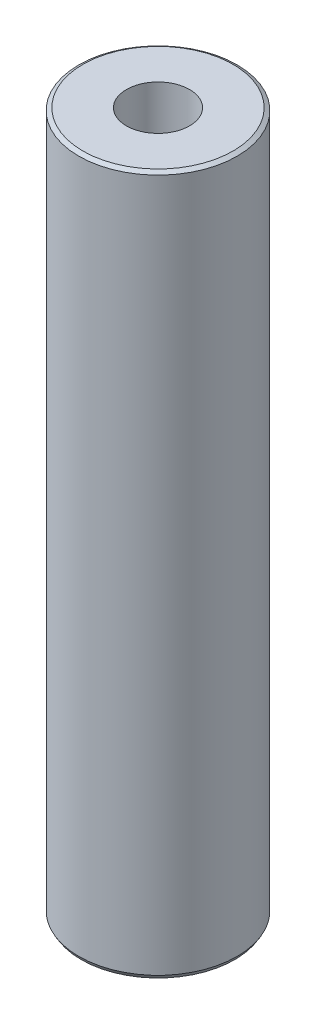
from build123d import *
from OCP.BRepFilletAPI import BRepFilletAPI_MakeChamfer

# Parameters (mm, degrees)
SKETCH1_R           = 27.5
BOSS_EXTRUDE1_DEPTH = 243.020051397
SKETCH2_R           = 10.956940153
CUT_EXTRUDE1_DEPTH  = 247.112261745
CHAMFER1_SIZE       = 0.850941379
CHAMFER1_SIZE2      = 1.410038431


with BuildPart() as part:
    # Sketch1 → Boss-Extrude1 (new body)
    with BuildSketch(Plane(origin=(0, 0, 0), x_dir=(1, 0, 0), z_dir=(0, 1, 0))):
        Circle(SKETCH1_R)
    extrude(amount=BOSS_EXTRUDE1_DEPTH)

    # Sketch2 → Cut-Extrude1 (cut, through all)
    with BuildSketch(Plane(origin=(0, 0, 0), x_dir=(1, 0, 0), z_dir=(0, 1, 0))):
        Circle(SKETCH2_R)
    extrude(amount=CUT_EXTRUDE1_DEPTH, mode=Mode.SUBTRACT)

    # Chamfer1: one chamfer whose edges measure the first distance from different faces: ONE call of the kernel's chamfer builder (chamfer() names one face for all edges)
    chamfer1_edges_1 = [part.edges().sort_by_distance(p)[0] for p in [
        (-27.5, 243.020051397, 0),
    ]]
    chamfer1_side_1 = [part.faces().sort_by_distance(p)[0] for p in [
        (-27.5, 121.510025699, 0),
    ]]
    chamfer1_edges_2 = [part.edges().sort_by_distance(p)[0] for p in [
        (-27.5, 0, 0),
    ]]
    chamfer1_side_2 = [part.faces().sort_by_distance(p)[0] for p in [
        (-26.722182541, 0, 0),
    ]]
    chamfer1 = BRepFilletAPI_MakeChamfer(part.part.solid().wrapped)
    for e in chamfer1_edges_1:
        chamfer1.Add(CHAMFER1_SIZE, CHAMFER1_SIZE2, e.wrapped, chamfer1_side_1[0].wrapped)  # the first distance lies on this face
    for e in chamfer1_edges_2:
        chamfer1.Add(CHAMFER1_SIZE, CHAMFER1_SIZE2, e.wrapped, chamfer1_side_2[0].wrapped)  # the first distance lies on this face
    add(Compound.cast(chamfer1.Shape()), mode=Mode.REPLACE)


solid = part.part
